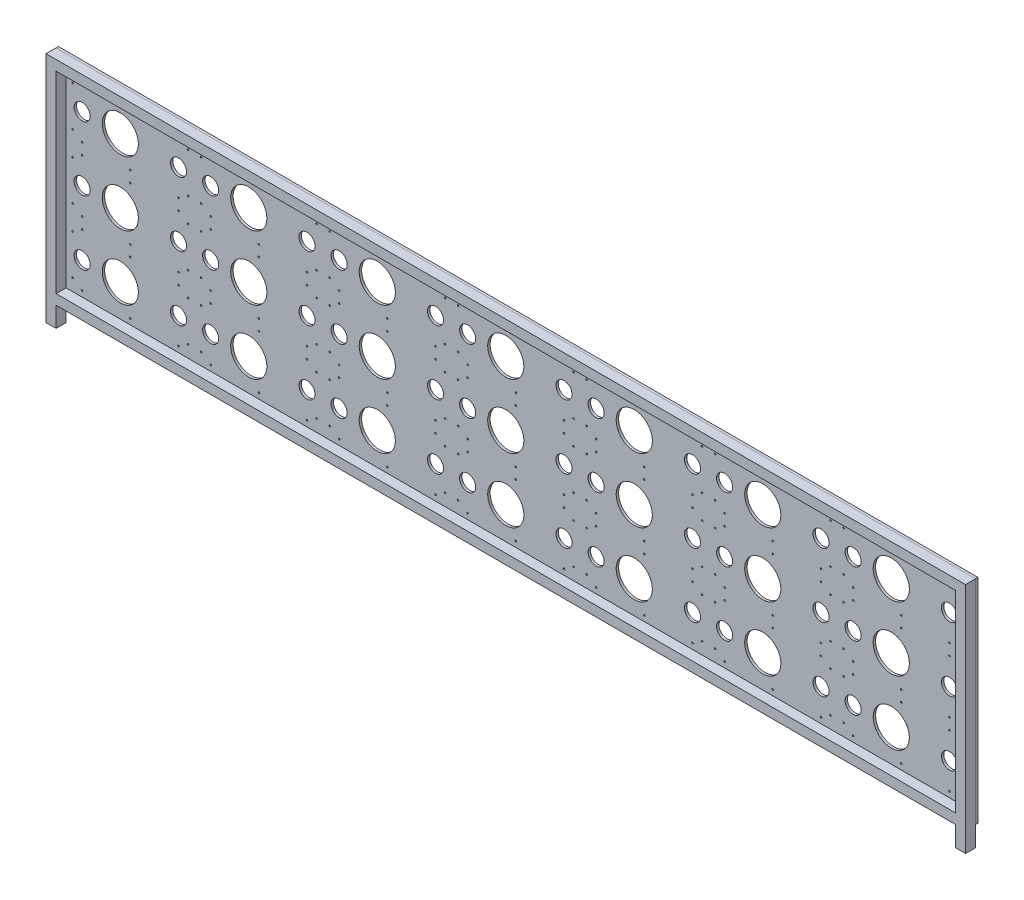
from build123d import *

# Parameters (mm, degrees)
SKETCH8_W           = 2290
SKETCH8_H           = 530
BOSS_EXTRUDE7_DEPTH = 6
SKETCH5_W           = 2240
SKETCH5_H           = 480
BOSS_EXTRUDE8_DEPTH = 25
SKETCH4_R           = 2
SKETCH4_R_2         = 20
SKETCH4_R_3         = 45
CUT_EXTRUDE1_DEPTH  = 1188.802593026


with BuildPart() as part:
    # Sketch8 → Boss-Extrude7 (new body)
    with BuildSketch(Plane.XY):
        Rectangle(SKETCH8_W, SKETCH8_H)
    extrude(amount=-BOSS_EXTRUDE7_DEPTH)

    # Sketch4 → Cut-Extrude1 (cut, through all)
    with BuildSketch(Plane.XY):
        with Locations((-1103.75, 210)):
            Circle(SKETCH4_R)
        with Locations((-1103.75, 110)):
            Circle(SKETCH4_R)
        with Locations((-960, 226.25)):
            Circle(SKETCH4_R)
        with Locations((-816.25, 210)):
            Circle(SKETCH4_R)
        with Locations((-960, 93.75)):
            Circle(SKETCH4_R)
        with Locations((-816.25, 110)):
            Circle(SKETCH4_R)
        with Locations((-1080, 94)):
            Circle(SKETCH4_R)
        with Locations((-1080, 226)):
            Circle(SKETCH4_R)
        with Locations((-840, 226)):
            Circle(SKETCH4_R)
        with Locations((-840, 94)):
            Circle(SKETCH4_R)
        with Locations((-760, 94)):
            Circle(SKETCH4_R)
        with Locations((-783.75, 110)):
            Circle(SKETCH4_R)
        with Locations((-760, 160)):
            Circle(SKETCH4_R_2)
        with Locations((-783.75, 210)):
            Circle(SKETCH4_R)
        with Locations((-760, 226)):
            Circle(SKETCH4_R)
        with Locations((-665, 160)):
            Circle(SKETCH4_R_3)
        with Locations((-640, 226.25)):
            Circle(SKETCH4_R)
        with Locations((-640, 93.75)):
            Circle(SKETCH4_R)
        with Locations((-520, 94)):
            Circle(SKETCH4_R)
        with Locations((-496.25, 110)):
            Circle(SKETCH4_R)
        with Locations((-520, 160)):
            Circle(SKETCH4_R_2)
        with Locations((-520, 226)):
            Circle(SKETCH4_R)
        with Locations((-496.25, 210)):
            Circle(SKETCH4_R)
        with Locations((-760, -66)):
            Circle(SKETCH4_R)
        with Locations((-783.75, -50)):
            Circle(SKETCH4_R)
        with Locations((-760, 0)):
            Circle(SKETCH4_R_2)
        with Locations((-783.75, 50)):
            Circle(SKETCH4_R)
        with Locations((-760, 66)):
            Circle(SKETCH4_R)
        with Locations((-665, 0)):
            Circle(SKETCH4_R_3)
        with Locations((-640, 66.25)):
            Circle(SKETCH4_R)
        with Locations((-640, -66.25)):
            Circle(SKETCH4_R)
        with Locations((-520, -66)):
            Circle(SKETCH4_R)
        with Locations((-496.25, -50)):
            Circle(SKETCH4_R)
        with Locations((-520, 0)):
            Circle(SKETCH4_R_2)
        with Locations((-520, 66)):
            Circle(SKETCH4_R)
        with Locations((-496.25, 50)):
            Circle(SKETCH4_R)
        with Locations((-1080, -226)):
            Circle(SKETCH4_R)
        with Locations((-1103.75, -210)):
            Circle(SKETCH4_R)
        with Locations((-1080, -160)):
            Circle(SKETCH4_R_2)
        with Locations((-1103.75, -110)):
            Circle(SKETCH4_R)
        with Locations((-1080, -94)):
            Circle(SKETCH4_R)
        with Locations((-985, -160)):
            Circle(SKETCH4_R_3)
        with Locations((-960, -93.75)):
            Circle(SKETCH4_R)
        with Locations((-960, -226.25)):
            Circle(SKETCH4_R)
        with Locations((-840, -226)):
            Circle(SKETCH4_R)
        with Locations((-816.25, -210)):
            Circle(SKETCH4_R)
        with Locations((-840, -160)):
            Circle(SKETCH4_R_2)
        with Locations((-840, -94)):
            Circle(SKETCH4_R)
        with Locations((-1080, 160)):
            Circle(SKETCH4_R_2)
        with Locations((-985, 160)):
            Circle(SKETCH4_R_3)
        with Locations((-840, 160)):
            Circle(SKETCH4_R_2)
        with Locations((-816.25, -110)):
            Circle(SKETCH4_R)
        with Locations((-760, -226)):
            Circle(SKETCH4_R)
        with Locations((-783.75, -210)):
            Circle(SKETCH4_R)
        with Locations((-760, -160)):
            Circle(SKETCH4_R_2)
        with Locations((-783.75, -110)):
            Circle(SKETCH4_R)
        with Locations((-760, -94)):
            Circle(SKETCH4_R)
        with Locations((-665, -160)):
            Circle(SKETCH4_R_3)
        with Locations((-640, -93.75)):
            Circle(SKETCH4_R)
        with Locations((-640, -226.25)):
            Circle(SKETCH4_R)
        with Locations((-520, -226)):
            Circle(SKETCH4_R)
        with Locations((-496.25, -210)):
            Circle(SKETCH4_R)
        with Locations((-520, -160)):
            Circle(SKETCH4_R_2)
        with Locations((-520, -94)):
            Circle(SKETCH4_R)
        with Locations((-496.25, -110)):
            Circle(SKETCH4_R)
        with Locations((-1080, -66)):
            Circle(SKETCH4_R)
        with Locations((-1103.75, -50)):
            Circle(SKETCH4_R)
        with Locations((-1080, 0)):
            Circle(SKETCH4_R_2)
        with Locations((-1103.75, 50)):
            Circle(SKETCH4_R)
        with Locations((-1080, 66)):
            Circle(SKETCH4_R)
        with Locations((-985, 0)):
            Circle(SKETCH4_R_3)
        with Locations((-960, 66.25)):
            Circle(SKETCH4_R)
        with Locations((-960, -66.25)):
            Circle(SKETCH4_R)
        with Locations((-840, -66)):
            Circle(SKETCH4_R)
        with Locations((-816.25, -50)):
            Circle(SKETCH4_R)
        with Locations((-840, 0)):
            Circle(SKETCH4_R_2)
        with Locations((-840, 66)):
            Circle(SKETCH4_R)
        with Locations((-816.25, 50)):
            Circle(SKETCH4_R)
        with Locations((-440, -226)):
            Circle(SKETCH4_R)
        with Locations((-463.75, -210)):
            Circle(SKETCH4_R)
        with Locations((-440, -160)):
            Circle(SKETCH4_R_2)
        with Locations((-463.75, -110)):
            Circle(SKETCH4_R)
        with Locations((-440, -94)):
            Circle(SKETCH4_R)
        with Locations((-345, -160)):
            Circle(SKETCH4_R_3)
        with Locations((-320, -93.75)):
            Circle(SKETCH4_R)
        with Locations((-320, -226.25)):
            Circle(SKETCH4_R)
        with Locations((-200, -226)):
            Circle(SKETCH4_R)
        with Locations((-176.25, -210)):
            Circle(SKETCH4_R)
        with Locations((-200, -160)):
            Circle(SKETCH4_R_2)
        with Locations((-200, -94)):
            Circle(SKETCH4_R)
        with Locations((-176.25, -110)):
            Circle(SKETCH4_R)
        with Locations((-120, -226)):
            Circle(SKETCH4_R)
        with Locations((-143.75, -210)):
            Circle(SKETCH4_R)
        with Locations((-120, -160)):
            Circle(SKETCH4_R_2)
        with Locations((-143.75, -110)):
            Circle(SKETCH4_R)
        with Locations((-120, -94)):
            Circle(SKETCH4_R)
        with Locations((-25, -160)):
            Circle(SKETCH4_R_3)
        with Locations((0, -93.75)):
            Circle(SKETCH4_R)
        with Locations((0, -226.25)):
            Circle(SKETCH4_R)
        with Locations((120, -226)):
            Circle(SKETCH4_R)
        with Locations((143.75, -210)):
            Circle(SKETCH4_R)
        with Locations((120, -160)):
            Circle(SKETCH4_R_2)
        with Locations((120, -94)):
            Circle(SKETCH4_R)
        with Locations((143.75, -110)):
            Circle(SKETCH4_R)
        with Locations((-440, 94)):
            Circle(SKETCH4_R)
        with Locations((-463.75, 110)):
            Circle(SKETCH4_R)
        with Locations((-440, 160)):
            Circle(SKETCH4_R_2)
        with Locations((-463.75, 210)):
            Circle(SKETCH4_R)
        with Locations((-440, 226)):
            Circle(SKETCH4_R)
        with Locations((-345, 160)):
            Circle(SKETCH4_R_3)
        with Locations((-320, 226.25)):
            Circle(SKETCH4_R)
        with Locations((-320, 93.75)):
            Circle(SKETCH4_R)
        with Locations((-200, 94)):
            Circle(SKETCH4_R)
        with Locations((-176.25, 110)):
            Circle(SKETCH4_R)
        with Locations((-200, 160)):
            Circle(SKETCH4_R_2)
        with Locations((-200, 226)):
            Circle(SKETCH4_R)
        with Locations((-176.25, 210)):
            Circle(SKETCH4_R)
        with Locations((-120, 94)):
            Circle(SKETCH4_R)
        with Locations((-143.75, 110)):
            Circle(SKETCH4_R)
        with Locations((-120, 160)):
            Circle(SKETCH4_R_2)
        with Locations((-143.75, 210)):
            Circle(SKETCH4_R)
        with Locations((-120, 226)):
            Circle(SKETCH4_R)
        with Locations((-25, 160)):
            Circle(SKETCH4_R_3)
        with Locations((0, 226.25)):
            Circle(SKETCH4_R)
        with Locations((0, 93.75)):
            Circle(SKETCH4_R)
        with Locations((120, 94)):
            Circle(SKETCH4_R)
        with Locations((143.75, 110)):
            Circle(SKETCH4_R)
        with Locations((120, 160)):
            Circle(SKETCH4_R_2)
        with Locations((120, 226)):
            Circle(SKETCH4_R)
        with Locations((143.75, 210)):
            Circle(SKETCH4_R)
        with Locations((200, 94)):
            Circle(SKETCH4_R)
        with Locations((176.25, 110)):
            Circle(SKETCH4_R)
        with Locations((200, 160)):
            Circle(SKETCH4_R_2)
        with Locations((176.25, 210)):
            Circle(SKETCH4_R)
        with Locations((200, 226)):
            Circle(SKETCH4_R)
        with Locations((295, 160)):
            Circle(SKETCH4_R_3)
        with Locations((320, 226.25)):
            Circle(SKETCH4_R)
        with Locations((320, 93.75)):
            Circle(SKETCH4_R)
        with Locations((440, 94)):
            Circle(SKETCH4_R)
        with Locations((463.75, 110)):
            Circle(SKETCH4_R)
        with Locations((440, 160)):
            Circle(SKETCH4_R_2)
        with Locations((440, 226)):
            Circle(SKETCH4_R)
        with Locations((463.75, 210)):
            Circle(SKETCH4_R)
        with Locations((520, 94)):
            Circle(SKETCH4_R)
        with Locations((496.25, 110)):
            Circle(SKETCH4_R)
        with Locations((520, 160)):
            Circle(SKETCH4_R_2)
        with Locations((496.25, 210)):
            Circle(SKETCH4_R)
        with Locations((520, 226)):
            Circle(SKETCH4_R)
        with Locations((615, 160)):
            Circle(SKETCH4_R_3)
        with Locations((640, 226.25)):
            Circle(SKETCH4_R)
        with Locations((640, 93.75)):
            Circle(SKETCH4_R)
        with Locations((760, 94)):
            Circle(SKETCH4_R)
        with Locations((783.75, 110)):
            Circle(SKETCH4_R)
        with Locations((760, 160)):
            Circle(SKETCH4_R_2)
        with Locations((760, 226)):
            Circle(SKETCH4_R)
        with Locations((783.75, 210)):
            Circle(SKETCH4_R)
        with Locations((840, 94)):
            Circle(SKETCH4_R)
        with Locations((816.25, 110)):
            Circle(SKETCH4_R)
        with Locations((840, 160)):
            Circle(SKETCH4_R_2)
        with Locations((816.25, 210)):
            Circle(SKETCH4_R)
        with Locations((840, 226)):
            Circle(SKETCH4_R)
        with Locations((935, 160)):
            Circle(SKETCH4_R_3)
        with Locations((960, 226.25)):
            Circle(SKETCH4_R)
        with Locations((960, 93.75)):
            Circle(SKETCH4_R)
        with Locations((1080, 94)):
            Circle(SKETCH4_R)
        with Locations((1103.75, 110)):
            Circle(SKETCH4_R)
        with Locations((1080, 160)):
            Circle(SKETCH4_R_2)
        with Locations((1080, 226)):
            Circle(SKETCH4_R)
        with Locations((1103.75, 210)):
            Circle(SKETCH4_R)
        with Locations((-440, -66)):
            Circle(SKETCH4_R)
        with Locations((-463.75, -50)):
            Circle(SKETCH4_R)
        with Locations((-440, 0)):
            Circle(SKETCH4_R_2)
        with Locations((-463.75, 50)):
            Circle(SKETCH4_R)
        with Locations((-440, 66)):
            Circle(SKETCH4_R)
        with Locations((-345, 0)):
            Circle(SKETCH4_R_3)
        with Locations((-320, 66.25)):
            Circle(SKETCH4_R)
        with Locations((-320, -66.25)):
            Circle(SKETCH4_R)
        with Locations((-200, -66)):
            Circle(SKETCH4_R)
        with Locations((-176.25, -50)):
            Circle(SKETCH4_R)
        with Locations((-200, 0)):
            Circle(SKETCH4_R_2)
        with Locations((-200, 66)):
            Circle(SKETCH4_R)
        with Locations((-176.25, 50)):
            Circle(SKETCH4_R)
        with Locations((-120, -66)):
            Circle(SKETCH4_R)
        with Locations((-143.75, -50)):
            Circle(SKETCH4_R)
        with Locations((-120, 0)):
            Circle(SKETCH4_R_2)
        with Locations((-143.75, 50)):
            Circle(SKETCH4_R)
        with Locations((-120, 66)):
            Circle(SKETCH4_R)
        with Locations((-25, 0)):
            Circle(SKETCH4_R_3)
        with Locations((0, 66.25)):
            Circle(SKETCH4_R)
        with Locations((0, -66.25)):
            Circle(SKETCH4_R)
        with Locations((120, -66)):
            Circle(SKETCH4_R)
        with Locations((143.75, -50)):
            Circle(SKETCH4_R)
        with Locations((120, 0)):
            Circle(SKETCH4_R_2)
        with Locations((120, 66)):
            Circle(SKETCH4_R)
        with Locations((143.75, 50)):
            Circle(SKETCH4_R)
        with Locations((200, -66)):
            Circle(SKETCH4_R)
        with Locations((176.25, -50)):
            Circle(SKETCH4_R)
        with Locations((200, 0)):
            Circle(SKETCH4_R_2)
        with Locations((176.25, 50)):
            Circle(SKETCH4_R)
        with Locations((200, 66)):
            Circle(SKETCH4_R)
        with Locations((295, 0)):
            Circle(SKETCH4_R_3)
        with Locations((320, 66.25)):
            Circle(SKETCH4_R)
        with Locations((320, -66.25)):
            Circle(SKETCH4_R)
        with Locations((440, -66)):
            Circle(SKETCH4_R)
        with Locations((463.75, -50)):
            Circle(SKETCH4_R)
        with Locations((440, 0)):
            Circle(SKETCH4_R_2)
        with Locations((440, 66)):
            Circle(SKETCH4_R)
        with Locations((463.75, 50)):
            Circle(SKETCH4_R)
        with Locations((520, -66)):
            Circle(SKETCH4_R)
        with Locations((496.25, -50)):
            Circle(SKETCH4_R)
        with Locations((520, 0)):
            Circle(SKETCH4_R_2)
        with Locations((496.25, 50)):
            Circle(SKETCH4_R)
        with Locations((520, 66)):
            Circle(SKETCH4_R)
        with Locations((615, 0)):
            Circle(SKETCH4_R_3)
        with Locations((640, 66.25)):
            Circle(SKETCH4_R)
        with Locations((640, -66.25)):
            Circle(SKETCH4_R)
        with Locations((760, -66)):
            Circle(SKETCH4_R)
        with Locations((783.75, -50)):
            Circle(SKETCH4_R)
        with Locations((760, 0)):
            Circle(SKETCH4_R_2)
        with Locations((760, 66)):
            Circle(SKETCH4_R)
        with Locations((783.75, 50)):
            Circle(SKETCH4_R)
        with Locations((840, -66)):
            Circle(SKETCH4_R)
        with Locations((816.25, -50)):
            Circle(SKETCH4_R)
        with Locations((840, 0)):
            Circle(SKETCH4_R_2)
        with Locations((816.25, 50)):
            Circle(SKETCH4_R)
        with Locations((840, 66)):
            Circle(SKETCH4_R)
        with Locations((935, 0)):
            Circle(SKETCH4_R_3)
        with Locations((960, 66.25)):
            Circle(SKETCH4_R)
        with Locations((960, -66.25)):
            Circle(SKETCH4_R)
        with Locations((1080, -66)):
            Circle(SKETCH4_R)
        with Locations((1103.75, -50)):
            Circle(SKETCH4_R)
        with Locations((1080, 0)):
            Circle(SKETCH4_R_2)
        with Locations((1080, 66)):
            Circle(SKETCH4_R)
        with Locations((1103.75, 50)):
            Circle(SKETCH4_R)
        with Locations((200, -226)):
            Circle(SKETCH4_R)
        with Locations((176.25, -210)):
            Circle(SKETCH4_R)
        with Locations((200, -160)):
            Circle(SKETCH4_R_2)
        with Locations((176.25, -110)):
            Circle(SKETCH4_R)
        with Locations((200, -94)):
            Circle(SKETCH4_R)
        with Locations((295, -160)):
            Circle(SKETCH4_R_3)
        with Locations((320, -93.75)):
            Circle(SKETCH4_R)
        with Locations((320, -226.25)):
            Circle(SKETCH4_R)
        with Locations((440, -226)):
            Circle(SKETCH4_R)
        with Locations((463.75, -210)):
            Circle(SKETCH4_R)
        with Locations((440, -160)):
            Circle(SKETCH4_R_2)
        with Locations((440, -94)):
            Circle(SKETCH4_R)
        with Locations((463.75, -110)):
            Circle(SKETCH4_R)
        with Locations((520, -226)):
            Circle(SKETCH4_R)
        with Locations((496.25, -210)):
            Circle(SKETCH4_R)
        with Locations((520, -160)):
            Circle(SKETCH4_R_2)
        with Locations((496.25, -110)):
            Circle(SKETCH4_R)
        with Locations((520, -94)):
            Circle(SKETCH4_R)
        with Locations((615, -160)):
            Circle(SKETCH4_R_3)
        with Locations((640, -93.75)):
            Circle(SKETCH4_R)
        with Locations((640, -226.25)):
            Circle(SKETCH4_R)
        with Locations((760, -226)):
            Circle(SKETCH4_R)
        with Locations((783.75, -210)):
            Circle(SKETCH4_R)
        with Locations((760, -160)):
            Circle(SKETCH4_R_2)
        with Locations((760, -94)):
            Circle(SKETCH4_R)
        with Locations((783.75, -110)):
            Circle(SKETCH4_R)
        with Locations((840, -226)):
            Circle(SKETCH4_R)
        with Locations((816.25, -210)):
            Circle(SKETCH4_R)
        with Locations((840, -160)):
            Circle(SKETCH4_R_2)
        with Locations((816.25, -110)):
            Circle(SKETCH4_R)
        with Locations((840, -94)):
            Circle(SKETCH4_R)
        with Locations((935, -160)):
            Circle(SKETCH4_R_3)
        with Locations((960, -93.75)):
            Circle(SKETCH4_R)
        with Locations((960, -226.25)):
            Circle(SKETCH4_R)
        with Locations((1080, -226)):
            Circle(SKETCH4_R)
        with Locations((1103.75, -210)):
            Circle(SKETCH4_R)
        with Locations((1080, -160)):
            Circle(SKETCH4_R_2)
        with Locations((1080, -94)):
            Circle(SKETCH4_R)
        with Locations((1103.75, -110)):
            Circle(SKETCH4_R)
    extrude(amount=-CUT_EXTRUDE1_DEPTH, mode=Mode.SUBTRACT)


with BuildPart() as body_2:
    # Sketch5 → Boss-Extrude8 (new body)
    with BuildSketch(Plane.XY):
        Polygon((-1145, 265), (1145, 265), (1145, -315), (1120, -315), (1120, -265), (-1120, -265), (-1120, -315), (-1145, -315), align=None)
        Rectangle(SKETCH5_W, SKETCH5_H, mode=Mode.SUBTRACT)
    extrude(amount=BOSS_EXTRUDE8_DEPTH)


solid = Compound([part.part, body_2.part])
